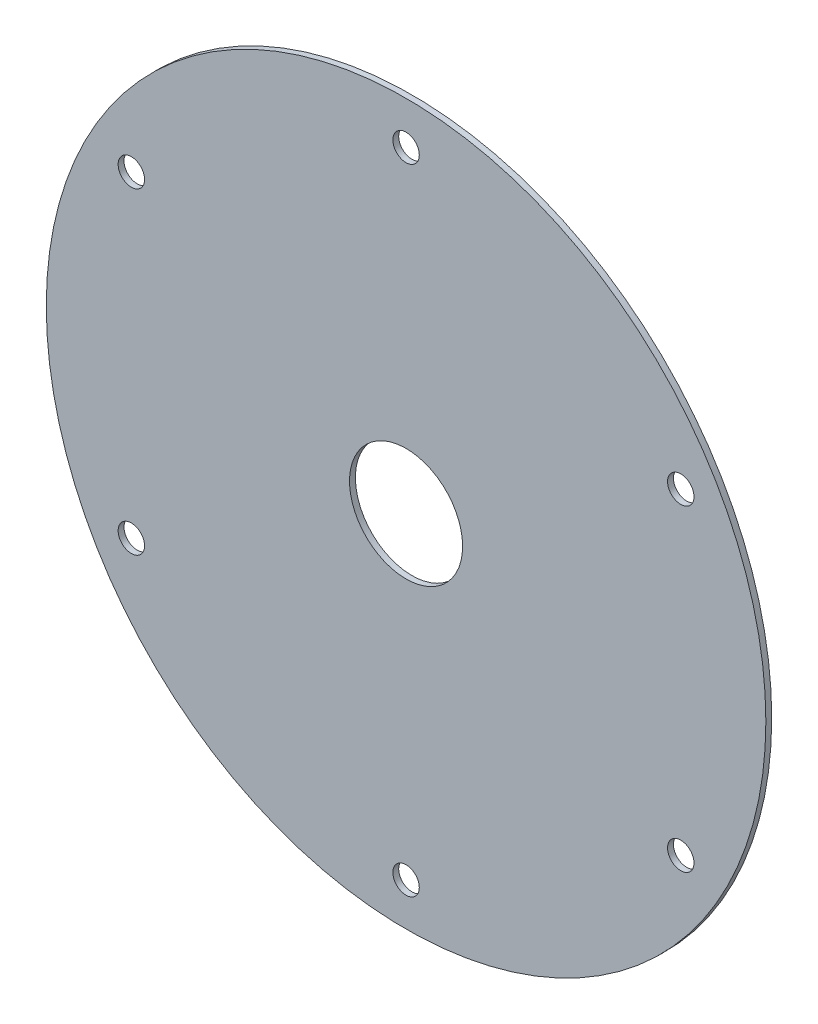
from build123d import *

# Parameters (mm, degrees)
SKETCH_1_R             = 245
SKETCH_1_R_2           = 38.5
SKETCH_1_R_3           = 9
SM_BASE_FLANGE_1_DEPTH = 4


# Sheet-metal steps are written as plain solids
with BuildPart() as part:
    # Sketch 1 → Базовая кромка1 (new body)
    with BuildSketch(Plane.XY):
        Circle(SKETCH_1_R)
        Circle(SKETCH_1_R_2, mode=Mode.SUBTRACT)
        with Locations((0, 216)):
            Circle(SKETCH_1_R_3, mode=Mode.SUBTRACT)
        with Locations((187.061487217, 108)):
            Circle(SKETCH_1_R_3, mode=Mode.SUBTRACT)
        with Locations((187.061487217, -108)):
            Circle(SKETCH_1_R_3, mode=Mode.SUBTRACT)
        with Locations((0, -216)):
            Circle(SKETCH_1_R_3, mode=Mode.SUBTRACT)
        with Locations((-187.061487217, -108)):
            Circle(SKETCH_1_R_3, mode=Mode.SUBTRACT)
        with Locations((-187.061487217, 108)):
            Circle(SKETCH_1_R_3, mode=Mode.SUBTRACT)
    extrude(amount=SM_BASE_FLANGE_1_DEPTH)


solid = part.part
